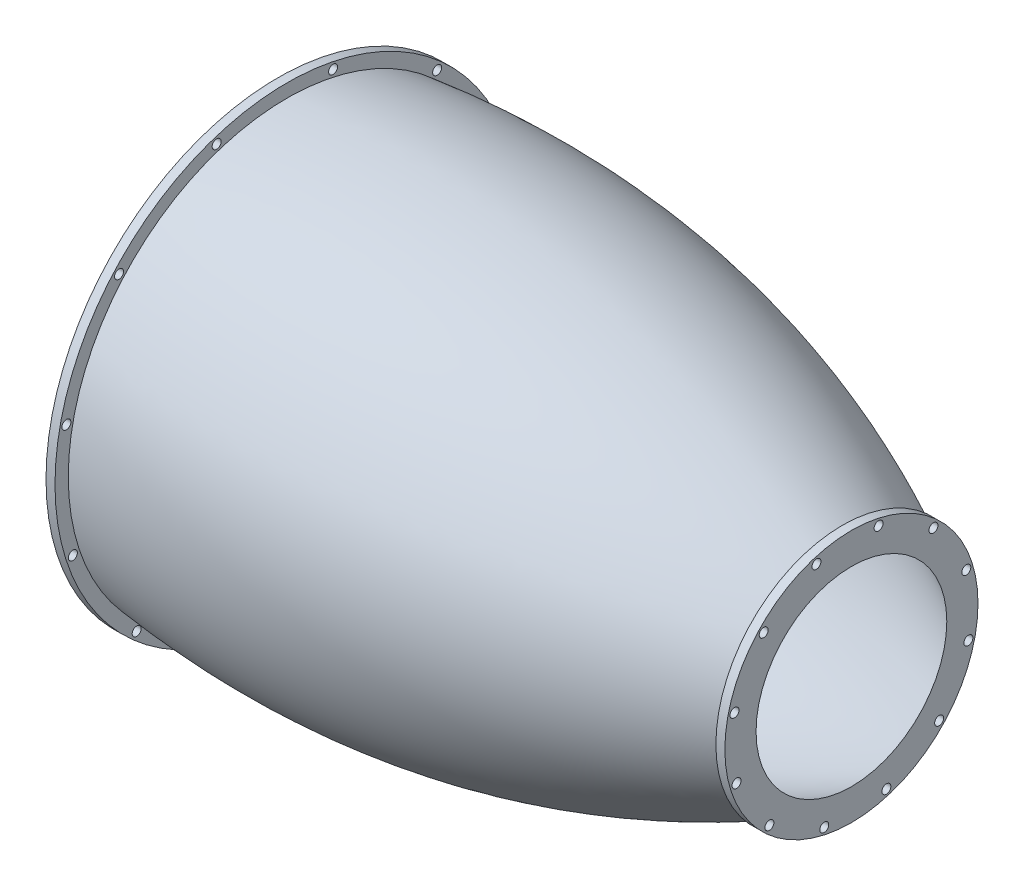
from build123d import *

# Parameters (mm, degrees)
SKETCH4_W           = 2299.140163329
SKETCH4_H           = 1084.867048291
CUT_EXTRUDE1_DEPTH  = 782.066
SKETCH5_R           = 89.428796415
SKETCH5_R_2         = 76.728796415
BOSS_EXTRUDE1_DEPTH = 6.35
SKETCH6_R           = 163.859870936
SKETCH6_R_2         = 153.699870936
BOSS_EXTRUDE2_DEPTH = 6.35
CIRPATTERN1_COUNT   = 12
CIRPATTERN2_COUNT   = 12


with BuildPart() as part:
    # Sketch1 → Revolve3 (revolve)
    with BuildSketch(Plane.XY):
        with BuildLine():
            Line((500, 330.2), (500, 339.09))
            add(Edge.make_bspline(
                [(0, 72.39), (163.777283466, 330.523765378), (500, 339.09)],
                knots=[0, 0, 0, 1, 1, 1], degree=2))
            add(Edge.make_bspline(
                [(0, 72.39), (-189.353547542, 181.782792201), (-412.824178468, 153.699870936)],
                knots=[0, 0, 0, 1, 1, 1], degree=2))
            Line((-412.824178468, 153.699870936), (-412.824178468, 144.809870936))
            add(Edge.make_bspline(
                [(0, 63.5), (-192.283511437, 162.67820459), (-412.824178468, 144.809870936)],
                knots=[0, 0, 0, 1, 1, 1], degree=2))
            add(Edge.make_bspline(
                [(0, 63.5), (163.777283466, 321.633765378), (500, 330.2)],
                knots=[0, 0, 0, 1, 1, 1], degree=2))
        make_face()
    revolve(axis=Axis((-1229.828239288, 0, 0), (1, 0, 0)))

    # Sketch4 → Cut-Extrude1 (cut)
    with BuildSketch(Plane.ZY.offset(7.62)):
        with Locations((-63.658537287, 96.480710784)):
            Rectangle(SKETCH4_W, SKETCH4_H)
    extrude(amount=-CUT_EXTRUDE1_DEPTH, mode=Mode.SUBTRACT)

    # Sketch5 → Boss-Extrude1 (add)
    with BuildSketch(Plane(origin=(-7.62, 0, 0), x_dir=(0, 0, -1), z_dir=(1, 0, 0))):
        Circle(SKETCH5_R)
        Circle(SKETCH5_R_2, mode=Mode.SUBTRACT)
    extrude(amount=-BOSS_EXTRUDE1_DEPTH)

    # Sketch6 → Boss-Extrude2 (add)
    with BuildSketch(Plane.ZY.offset(412.824178468)):
        Circle(SKETCH6_R)
        Circle(SKETCH6_R_2, mode=Mode.SUBTRACT)
    extrude(amount=-BOSS_EXTRUDE2_DEPTH)

    # Sketch8 → 1/4 (0.25) Diameter Hole1 (revolve, cut)
    with BuildSketch(Plane(origin=(-13.97, -82.639263297, 19.191795215), x_dir=(0, 0, 1), z_dir=(0, 1, 0))):
        Polygon((0, 0), (0, 8.257732465), (3.175, 6.35), (3.175, 0), align=None)
    f_1_4_0_25_diameter_hole1 = revolve(axis=Axis((-20.32, -82.639263297, 19.191795215), (1, 0, 0)), mode=Mode.SUBTRACT)

    # CirPattern1: 1/4 (0.25) Diameter Hole1 ×12 about axis
    cirpattern1_axis = Axis((-13.97, 0, 0), (1, 0, 0))
    for i in range(1, CIRPATTERN1_COUNT):
        add(f_1_4_0_25_diameter_hole1.rotate(cirpattern1_axis, i * 360 / CIRPATTERN1_COUNT), mode=Mode.SUBTRACT)

    # Sketch10 → 1/4 (0.25) Diameter Hole2 (revolve, cut)
    with BuildSketch(Plane(origin=(-406.474178468, -155.786196065, 32.623354297), x_dir=(0, 0, -1), z_dir=(0, 1, 0))):
        Polygon((0, 0), (0, 8.257732465), (3.175, 6.35), (3.175, 0), align=None)
    f_1_4_0_25_diameter_hole2 = revolve(axis=Axis((-400.124178468, -155.786196065, 32.623354297), (-1, 0, 0)), mode=Mode.SUBTRACT)

    # CirPattern2: 1/4 (0.25) Diameter Hole2 ×12 about axis
    cirpattern2_axis = Axis((-406.474178468, 0, 0), (-1, 0, 0))
    for i in range(1, CIRPATTERN2_COUNT):
        add(f_1_4_0_25_diameter_hole2.rotate(cirpattern2_axis, i * 360 / CIRPATTERN2_COUNT), mode=Mode.SUBTRACT)


solid = part.part
